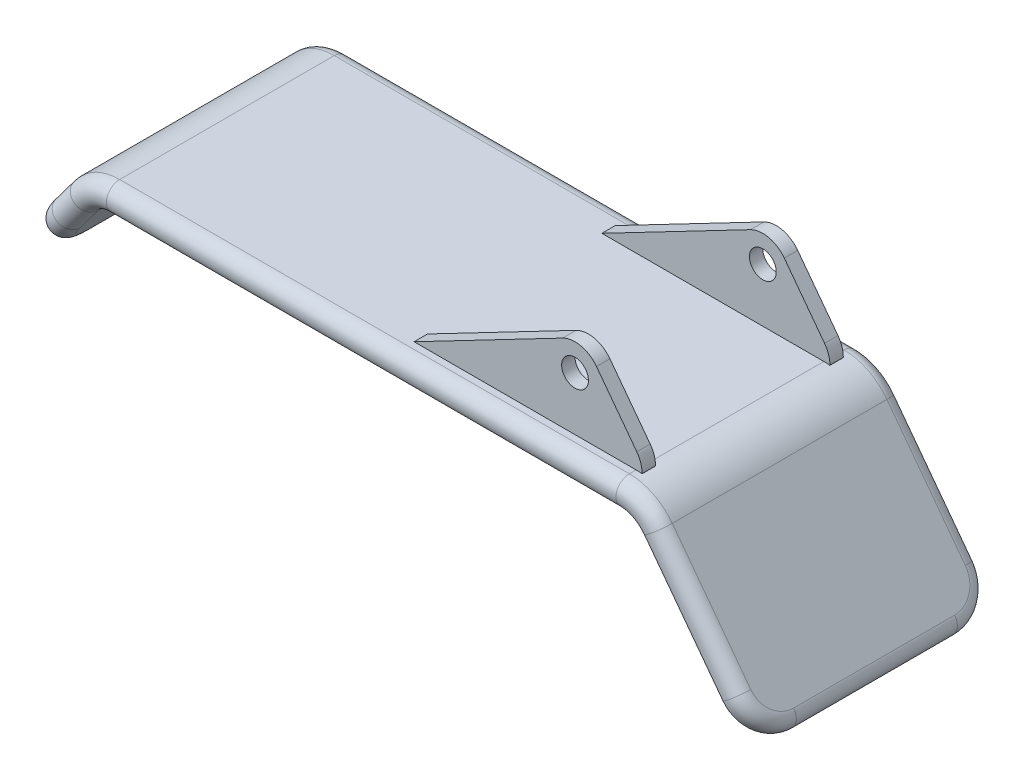
from build123d import *

# Parameters (mm, degrees)
EXTRUDE_THIN1_DEPTH = 9
FILLET1_R           = 3
FILLET2_R           = 1
SKETCH2_R           = 1
EXTRUDE1_DEPTH      = 1


with BuildPart() as part:
    # Sketch1 → Extrude-Thin1 (new, symmetric)
    with BuildSketch(Plane.XY):
        with BuildLine():
            Line((-23.75, -5), (-20.6, -0.8))
            ThreePointArc((-20.6, -0.8), (-19.894427191, -0.211145618), (-19, 0))
            Line((-19, 0), (19, 0))
            ThreePointArc((19, 0), (19.894427191, -0.211145618), (20.6, -0.8))
            Line((20.6, -0.8), (28.25, -11))
            Line((28.25, -11), (29.85, -9.8))
            Line((29.85, -9.8), (22.2, 0.4))
            ThreePointArc((22.2, 0.4), (20.788854382, 1.577708764), (19, 2))
            Line((19, 2), (-19, 2))
            ThreePointArc((-19, 2), (-20.788854382, 1.577708764), (-22.2, 0.4))
            Line((-22.2, 0.4), (-25.35, -3.8))
            Line((-25.35, -3.8), (-23.75, -5))
        make_face()
    extrude(amount=EXTRUDE_THIN1_DEPTH, both=True)

    # Fillet1
    fillet1_edges = [part.edges().sort_by_distance(p)[0] for p in [
        (29.05, -10.4, -9),
        (-24.55, -4.4, -9),
        (29.05, -10.4, 9),
        (-24.55, -4.4, 9),
    ]]
    fillet(fillet1_edges, radius=FILLET1_R)

    # Fillet2
    fillet2_edges = [part.edges().sort_by_distance(p)[0] for p in [
        (-21.275, -1.7, 9),
        (20.788854382, 1.577708764, -9),
        (0, 0, -9),
        (-20.788854382, 1.577708764, -9),
        (-21.275, -1.7, -9),
        (-22.875, -0.5, -9),
        (-20.788854382, 1.577708764, 9),
        (0, 0, 9),
        (20.788854382, 1.577708764, 9),
        (-23.75, -5, 0),
        (-25.35, -3.8, 0),
        (-24.822792206, -3.097056275, -8.121320344),
        (-24.822792206, -3.097056275, 8.121320344),
        (0, 2, 9),
        (23.525, -4.7, 9),
        (25.125, -3.5, 9),
        (25.125, -3.5, -9),
        (23.525, -4.7, -9),
        (28.25, -11, 0),
        (27.722792206, -10.297056275, 8.121320344),
        (-22.875, -0.5, 9),
        (27.722792206, -10.297056275, -8.121320344),
        (29.85, -9.8, 0),
        (0, 2, -9),
    ]]
    fillet(fillet2_edges, radius=FILLET2_R - 0.0001)  # a hair under: the kernel refuses the full size

    # Sketch2 → Extrude1 (add)
    with BuildSketch(Plane.XY.offset(7.5)):
        with BuildLine():
            Line((2.45, 2), (13.5255002, 7.7734994))
            ThreePointArc((13.5255002, 7.7734994), (14.893058146, 7.950307535), (16.05, 7.2))
            Line((16.05, 7.2), (19.05, 3.2))
            ThreePointArc((19.05, 3.2), (19.347366596, 2.632455532), (19.45, 2))
            Line((19.45, 2), (19.45, 1.974606899))
            ThreePointArc((19.45, 1.974606899), (19.225357943, 1.993646679), (19, 2))
            Line((19, 2), (2.45, 2))
        make_face()
        with Locations((14.45, 6)):
            Circle(SKETCH2_R, mode=Mode.SUBTRACT)
    extrude1 = extrude(amount=-EXTRUDE1_DEPTH)

    # Mirror1: Extrude1 across plane
    add(extrude1.mirror(Plane.XY))


solid = part.part
